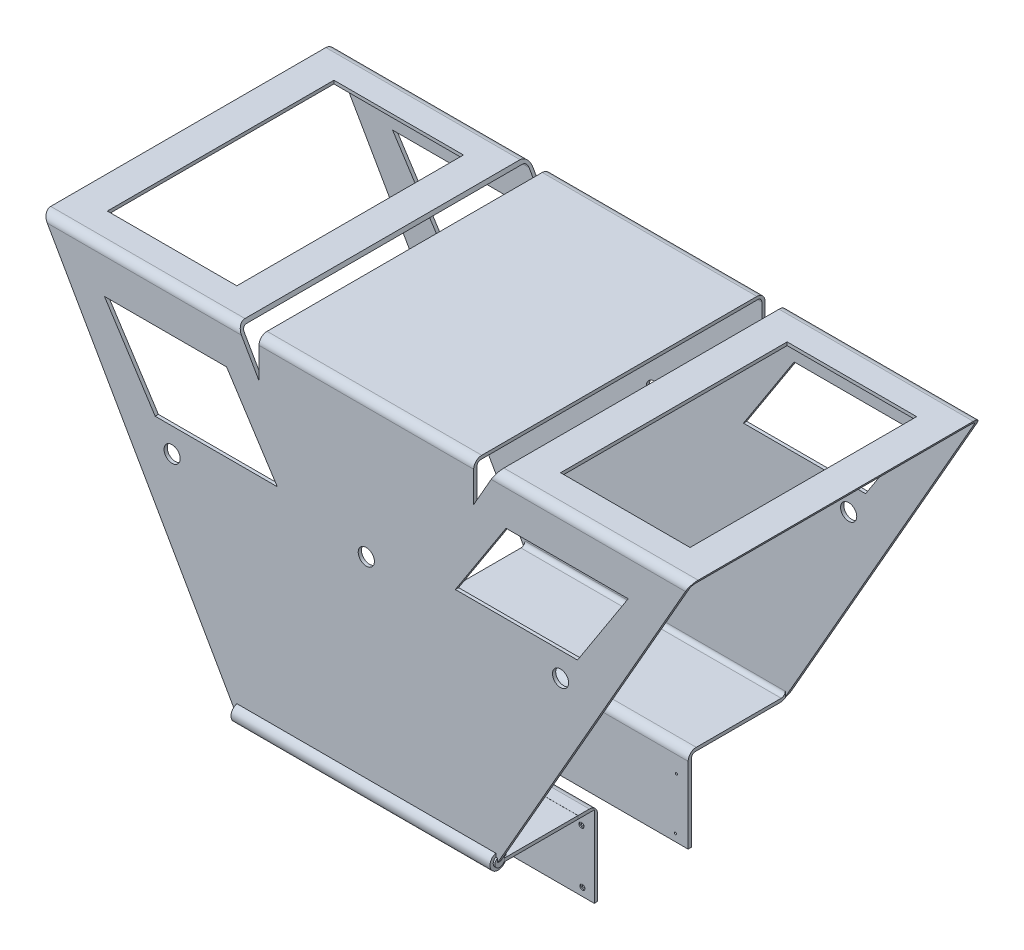
from build123d import *

# Parameters (mm, degrees)
SKETCH1_W                                     = 66.315789474
SKETCH1_H                                     = 210
BOSS_EXTRUDE2_DEPTH                           = 180
SHELL2_T                                      = -2
SKETCH3_W                                     = 80
SKETCH3_H                                     = 140
CUT_EXTRUDE2_DEPTH                            = 2
BOSS_EXTRUDE3_DEPTH                           = 2
BOSS_EXTRUDE3_DEPTH_BACK                      = 50
SKETCH5_W                                     = 160.82480279
SKETCH5_H                                     = 176
CUT_EXTRUDE6_DEPTH                            = 2
CUT_EXTRUDE6_DEPTH_BACK                       = 125
SKETCH7_W                                     = 160.82480279
SKETCH7_H                                     = 56
SHELL7_START                                  = -155
SHELL7_OUTLINE_W                              = 160.82480279
SHELL7_OUTLINE_H                              = 58
SHELL7_DEPTH                                  = 50
CUT_EXTRUDE14_DEPTH                           = 115
CUT_EXTRUDE14_DEPTH_BACK                      = 3
SKETCH10_W                                    = 160.82480279
SKETCH10_H                                    = 0.05
SKETCH11_W                                    = 41.857328139
SKETCH11_H                                    = 20
BOSS_EXTRUDE4_DEPTH                           = 3
SKETCH21_R                                    = 1
CUT_EXTRUDE15_DEPTH                           = 6
BOSS_EXTRUDE5_DEPTH                           = 80
BOSS_EXTRUDE5_DEPTH_BACK                      = 80
SKETCH23_R                                    = 5
BOSS_EXTRUDE6_DEPTH                           = 1
BOSS_EXTRUDE6_DEPTH_BACK                      = 161
SKETCH24_R                                    = 3
CBORE_FOR_00_BINDING_HEAD_MACHINE_S_2_COUNT   = 2
CBORE_FOR_00_BINDING_HEAD_MACHINE_S_2_PITCH   = 32.157826925
CBORE_FOR_00_BINDING_HEAD_MACHINE_S_3_A_COUNT = 2
CBORE_FOR_00_BINDING_HEAD_MACHINE_S_3_A_PITCH = 32.942533471
FILLET5_R                                     = 5
FILLET6_R                                     = 5
FILLET7_R                                     = 2.5
FILLET8_R                                     = 2.5
FILLET9_R                                     = 5
FILLET10_R                                    = 2.5
FILLET11_R                                    = 5
FILLET12_R                                    = 5
FILLET13_R                                    = 5
FILLET14_R                                    = 5
FILLET15_R                                    = 2.5
FILLET16_R                                    = 2.5
FILLET17_R                                    = 2.5
FILLET18_R                                    = 2.5
SKETCH31_R                                    = 5
CUT_EXTRUDE16_DEPTH                           = 180
SKETCH32_R                                    = 5
CUT_EXTRUDE17_DEPTH                           = 180
CUT_EXTRUDE18_DEPTH                           = 180


# Read off the part's stored shape, not the designer's step: Shell7
with BuildPart() as part:
    # Sketch1 → Boss-Extrude2 (new body)
    with BuildSketch(Plane.XY):
        Polygon((-40, -105), (80, -105), (200, 105), (80, 105), align=None)
        with Locations((33.157894737, 0)):
            Rectangle(SKETCH1_W, SKETCH1_H)
    boss_extrude2 = extrude(amount=BOSS_EXTRUDE2_DEPTH)

    # Mirror2: Boss-Extrude2 across plane
    add(boss_extrude2.mirror(Plane(origin=(0, 0, 0), x_dir=(0, 0, 1), z_dir=(1, 0, 0))))

    # Shell2
    shell2_openings = [part.faces().sort_by_distance(p)[0] for p in [
        (66.315789474, 93.026315789, 90),
        (-73.157894737, 93.026315789, 90),
        (-140, 0, 90),
        (-66.315789474, 93.026315789, 90),
        (73.157894737, 93.026315789, 90),
        (140, 0, 90),
        (0, -105, 90),
    ]]
    offset(amount=SHELL2_T, openings=shell2_openings, kind=Kind.INTERSECTION)

    # Sketch3 → Cut-Extrude2 (cut)
    with BuildSketch(Plane(origin=(0, 105, 0), x_dir=(1, 0, 0), z_dir=(0, 1, 0))):
        with Locations((140, -90)):
            Rectangle(SKETCH3_W, SKETCH3_H)
    cut_extrude2 = extrude(amount=-CUT_EXTRUDE2_DEPTH, mode=Mode.SUBTRACT)

    # Mirror4: Cut-Extrude2 across plane
    add(cut_extrude2.mirror(Plane(origin=(0, 0, 0), x_dir=(0, 0, 1), z_dir=(1, 0, 0))), mode=Mode.SUBTRACT)

    # Sketch5 → Boss-Extrude3 (add, two sides: drawn at the far end of the back side and taken through both)
    with BuildSketch(Plane(origin=(0, -105, 0), x_dir=(1, 0, 0), z_dir=(0, 1, 0)).offset(-BOSS_EXTRUDE3_DEPTH_BACK)):
        with Locations((0.412401395, -90)):
            Rectangle(SKETCH5_W, SKETCH5_H)
    extrude(amount=BOSS_EXTRUDE3_DEPTH + BOSS_EXTRUDE3_DEPTH_BACK)

    # Sketch7 → Cut-Extrude6 (cut, two sides: drawn at the far end of the back side and taken through both)
    with BuildSketch(Plane(origin=(0, -155, 0), x_dir=(-1, 0, 0), z_dir=(0, -1, 0)).offset(-CUT_EXTRUDE6_DEPTH_BACK)):
        with Locations((-0.412401395, -90)):
            Rectangle(SKETCH7_W, SKETCH7_H)
    extrude(amount=CUT_EXTRUDE6_DEPTH + CUT_EXTRUDE6_DEPTH_BACK, mode=Mode.SUBTRACT)

    # Shell7 outline → Shell7 (cut)
    with BuildSketch(Plane(origin=(0, 0, 0), x_dir=(1, 0, 0), z_dir=(0, 1, 0)).offset(SHELL7_START)):
        with Locations((0.412401395, -149)):
            Rectangle(SHELL7_OUTLINE_W, SHELL7_OUTLINE_H)
        with Locations((0.412401395, -31)):
            Rectangle(SHELL7_OUTLINE_W, SHELL7_OUTLINE_H)
    extrude(amount=SHELL7_DEPTH, mode=Mode.SUBTRACT)

    # Sketch10 → Cut-Extrude14 (cut, two sides: drawn at the far end of the back side and taken through both)
    with BuildSketch(Plane(origin=(0, -105, 0), x_dir=(-1, 0, 0), z_dir=(0, -1, 0)).offset(-CUT_EXTRUDE14_DEPTH_BACK)):
        with Locations((-0.412401395, -130.025)):
            Rectangle(SKETCH10_W, SKETCH10_H)
    extrude(amount=CUT_EXTRUDE14_DEPTH + CUT_EXTRUDE14_DEPTH_BACK, mode=Mode.SUBTRACT)


with BuildPart() as cut_extrude14_piece_1:
    # of the separate pieces the step leaves, piece 1, a body of its own (cut_extrude14_pieces)
    add(part.part.solids().sort_by_distance((200, 105, 0))[0])



with BuildPart() as cut_extrude14_piece_2:
    # of the separate pieces the step leaves, piece 2, a body of its own (cut_extrude14_pieces)
    add(part.part.solids().sort_by_distance((-80, -105, 120))[0])


with BuildPart() as cut_extrude14_piece_1_1:
    add(cut_extrude14_piece_1.part)

    add(cut_extrude14_piece_2.part)  # Boss-Extrude4 merges Cut-Extrude14 piece 2
    # Sketch11 → Boss-Extrude4 (add)
    with BuildSketch(Plane(origin=(0, -105, 0), x_dir=(-1, 0, 0), z_dir=(0, -1, 0))):
        with Locations((-3.423740306, -130)):
            Rectangle(SKETCH11_W, SKETCH11_H)
    extrude(amount=BOSS_EXTRUDE4_DEPTH)

    # Sketch21 → Cut-Extrude15 (cut)
    with BuildSketch(Plane.XZ.offset(108)):
        with Locations(Location((-7.504923764, 125, 0), (0, 0, 270))):
            Circle(SKETCH21_R)
    cut_extrude15 = extrude(amount=-CUT_EXTRUDE15_DEPTH, mode=Mode.SUBTRACT)

    # Mirror5: Cut-Extrude15 across plane
    add(cut_extrude15.mirror(Plane(origin=(0, 0, 0), x_dir=(0, 0, 1), z_dir=(1, 0, 0))), mode=Mode.SUBTRACT)

    # Sketch23 → Boss-Extrude5 (add, two sides: drawn at the far end of the back side and taken through both)
    with BuildSketch(Plane(origin=(0, 0, 0), x_dir=(0, 0, -1), z_dir=(1, 0, 0)).offset(-BOSS_EXTRUDE5_DEPTH_BACK)):
        with Locations((-178.603855449, -103.36849277)):
            Circle(SKETCH23_R)
    extrude(amount=BOSS_EXTRUDE5_DEPTH + BOSS_EXTRUDE5_DEPTH_BACK)

    # Sketch24 → Boss-Extrude6 (add, two sides: drawn at the far end of the back side and taken through both)
    with BuildSketch(Plane(origin=(80, 0, 0), x_dir=(0, 0, -1), z_dir=(1, 0, 0)).offset(-BOSS_EXTRUDE6_DEPTH_BACK)):
        with Locations((-178.603855449, -103.36849277)):
            Circle(SKETCH24_R)
    extrude(amount=BOSS_EXTRUDE6_DEPTH + BOSS_EXTRUDE6_DEPTH_BACK)

    # Sketch26 → CBORE for _00 Binding Head Machine Screw (revolve, cut)
    with BuildSketch(Plane(origin=(72.978328707, -150.455571789, 60), x_dir=(0, 1, 0), z_dir=(1, 0, 0))):
        Polygon((0, 0), (0, 10.419701142), (0.6985, 10), (0.6985, 0.7112), (1.5875, 0.7112), (1.5875, 0), align=None)
    cbore_for_00_binding_head_machine_screw = revolve(axis=Axis((72.978328707, -150.455571789, 53.65), (0, 0, 1)), mode=Mode.SUBTRACT)

    # CBORE for _00 Binding Head Machine S 2: CBORE for _00 Binding Head Machine Screw ×2
    with Locations(*[Vector(0.01829609981104793, 0.9998326123565405, 0) * (i * CBORE_FOR_00_BINDING_HEAD_MACHINE_S_2_PITCH) for i in range(1, CBORE_FOR_00_BINDING_HEAD_MACHINE_S_2_COUNT)]):
        add(cbore_for_00_binding_head_machine_screw, mode=Mode.SUBTRACT)

    # Mirror6: CBORE for _00 Binding Head Machine Screw across plane
    add(cbore_for_00_binding_head_machine_screw.mirror(Plane(origin=(0, 0, 0), x_dir=(0, 0, 1), z_dir=(1, 0, 0))), mode=Mode.SUBTRACT)

    # Mirror6 copy 1 sketch → Mirror6 copy 1 (revolve, cut)
    with BuildSketch(Plane(origin=(-73.566691518, -118.303127687, 60), x_dir=(0, 1, 0), z_dir=(-1, 0, 0))):
        Polygon((0, 0), (0, -10.419701142), (0.6985, -10), (0.6985, -0.7112), (1.5875, -0.7112), (1.5875, 0), align=None)
    revolve(axis=Axis((-73.566691518, -118.303127687, 53.65), (0, 0, -1)), mode=Mode.SUBTRACT)

    # Sketch30 → CBORE for _00 Binding Head Machine S 3 (revolve, cut)
    with BuildSketch(Plane(origin=(-72.900397692, -117.098816349, 120), x_dir=(0, -1, 0), z_dir=(1, 0, 0))):
        Polygon((0, 0), (0, 10.419701142), (0.6985, 10), (0.6985, 0.7112), (1.5875, 0.7112), (1.5875, 0), align=None)
    cbore_for_00_binding_head_machine_s_3 = revolve(axis=Axis((-72.900397692, -117.098816349, 126.35), (0, 0, -1)), mode=Mode.SUBTRACT)

    # CBORE for _00 Binding Head Machine S 3 a: CBORE for _00 Binding Head Machine S 3 ×2
    with Locations(*[Vector(-0.01718488428642269, -0.999852328972665, 0) * (i * CBORE_FOR_00_BINDING_HEAD_MACHINE_S_3_A_PITCH) for i in range(1, CBORE_FOR_00_BINDING_HEAD_MACHINE_S_3_A_COUNT)]):
        add(cbore_for_00_binding_head_machine_s_3, mode=Mode.SUBTRACT)

    # Mirror7: CBORE for _00 Binding Head Machine S 3 across plane
    add(cbore_for_00_binding_head_machine_s_3.mirror(Plane(origin=(0, 0, 0), x_dir=(0, 0, 1), z_dir=(1, 0, 0))), mode=Mode.SUBTRACT)

    # Mirror7 copy 1 sketch → Mirror7 copy 1 (revolve, cut)
    with BuildSketch(Plane(origin=(73.466511318, -150.036485163, 120), x_dir=(0, -1, 0), z_dir=(-1, 0, 0))):
        Polygon((0, 0), (0, -10.419701142), (0.6985, -10), (0.6985, -0.7112), (1.5875, -0.7112), (1.5875, 0), align=None)
    revolve(axis=Axis((73.466511318, -150.036485163, 126.35), (0, 0, 1)), mode=Mode.SUBTRACT)

    # Fillet5
    fillet5_edges = [cut_extrude14_piece_1_1.edges().sort_by_distance(p)[0] for p in [
        (0.412401395, -103, 118),
    ]]
    fillet(fillet5_edges, radius=FILLET5_R)

    # Fillet6
    fillet6_edges = [cut_extrude14_piece_1_1.edges().sort_by_distance(p)[0] for p in [
        (0.412401395, -103, 62),
    ]]
    fillet(fillet6_edges, radius=FILLET6_R)

    # Fillet7
    fillet7_edges = [cut_extrude14_piece_1_1.edges().sort_by_distance(p)[0] for p in [
        (0.412401395, -103, 2),
    ]]
    fillet(fillet7_edges, radius=FILLET7_R)

    # Fillet8
    fillet8_edges = [cut_extrude14_piece_1_1.edges().sort_by_distance(p)[0] for p in [
        (0.412401395, -105, 60),
    ]]
    fillet(fillet8_edges, radius=FILLET8_R)

    # Fillet9
    # the kernel refuses this fillet: 5 mm, written as the material it takes off along each edge
    with BuildSketch(Plane(origin=(-92.5, -105, 0), x_dir=(0, 0, 1), z_dir=(1, 0, 0))) as fillet9_piece_1:
        with BuildLine():
            CenterArc((FILLET9_R, -FILLET9_R), FILLET9_R, 90, 90)
            Line((0, -FILLET9_R), (0, 0))
            Line((0, 0), (FILLET9_R, 0))
        make_face()
    extrude(amount=185, mode=Mode.SUBTRACT)

    # Fillet10
    fillet10_edges = [cut_extrude14_piece_1_1.edges().sort_by_distance(p)[0] for p in [
        (-48.752461882, -105, 120),
    ]]
    fillet(fillet10_edges, radius=FILLET10_R)

    # Fillet11
    fillet11_edges = [cut_extrude14_piece_1_1.edges().sort_by_distance(p)[0] for p in [
        (0, 105, 180),
    ]]
    fillet(fillet11_edges, radius=FILLET11_R)

    # Fillet12
    fillet12_edges = [cut_extrude14_piece_1_1.edges().sort_by_distance(p)[0] for p in [
        (-140, 105, 180),
    ]]
    fillet(fillet12_edges, radius=FILLET12_R)

    # Fillet13
    fillet13_edges = [cut_extrude14_piece_1_1.edges().sort_by_distance(p)[0] for p in [
        (140, 105, 180),
    ]]
    fillet(fillet13_edges, radius=FILLET13_R)

    # Fillet14
    fillet14_edges = [cut_extrude14_piece_1_1.edges().sort_by_distance(p)[0] for p in [
        (-140, 105, 0),
        (0, 105, 0),
        (140, 105, 0),
    ]]
    fillet(fillet14_edges, radius=FILLET14_R)

    # Fillet15
    fillet15_edges = [cut_extrude14_piece_1_1.edges().sort_by_distance(p)[0] for p in [
        (-138.857142857, 103, 178),
        (0, 103, 178),
        (138.857142857, 103, 178),
    ]]
    fillet(fillet15_edges, radius=FILLET15_R)

    # Fillet16
    fillet16_edges = [cut_extrude14_piece_1_1.edges().sort_by_distance(p)[0] for p in [
        (-138.857142857, 103, 2),
    ]]
    fillet(fillet16_edges, radius=FILLET16_R)

    # Fillet17
    fillet17_edges = [cut_extrude14_piece_1_1.edges().sort_by_distance(p)[0] for p in [
        (0, 103, 2),
    ]]
    fillet(fillet17_edges, radius=FILLET17_R)

    # Fillet18
    fillet18_edges = [cut_extrude14_piece_1_1.edges().sort_by_distance(p)[0] for p in [
        (138.857142857, 103, 2),
    ]]
    fillet(fillet18_edges, radius=FILLET18_R)

    # Sketch31 → Cut-Extrude16 (cut)
    with BuildSketch(Plane.XY.offset(180)):
        with Locations((-120, 15)):
            Circle(SKETCH31_R)
    cut_extrude16 = extrude(amount=-CUT_EXTRUDE16_DEPTH, mode=Mode.SUBTRACT)

    # Mirror8: Cut-Extrude16 across plane
    add(cut_extrude16.mirror(Plane(origin=(0, 0, 0), x_dir=(0, 0, 1), z_dir=(1, 0, 0))), mode=Mode.SUBTRACT)

    # Sketch32 → Cut-Extrude17 (cut)
    with BuildSketch(Plane.XY.offset(180)):
        with Locations((0, 20)):
            Circle(SKETCH32_R)
    extrude(amount=-CUT_EXTRUDE17_DEPTH, mode=Mode.SUBTRACT)

    # Sketch33 → Cut-Extrude18 (cut)
    with BuildSketch(Plane(origin=(0, 0, 0), x_dir=(-1, 0, 0), z_dir=(0, 0, -1))):
        Polygon((-161.789181425, 78.442356236), (-86.315789474, 78.442356236), (-54.986218904, 30), (-130.459610855, 30), align=None)
    cut_extrude18 = extrude(amount=-CUT_EXTRUDE18_DEPTH, mode=Mode.SUBTRACT)

    # Mirror10: Cut-Extrude18 across plane
    add(cut_extrude18.mirror(Plane(origin=(0, 0, 0), x_dir=(0, 0, 1), z_dir=(1, 0, 0))), mode=Mode.SUBTRACT)


solid = cut_extrude14_piece_1_1.part
